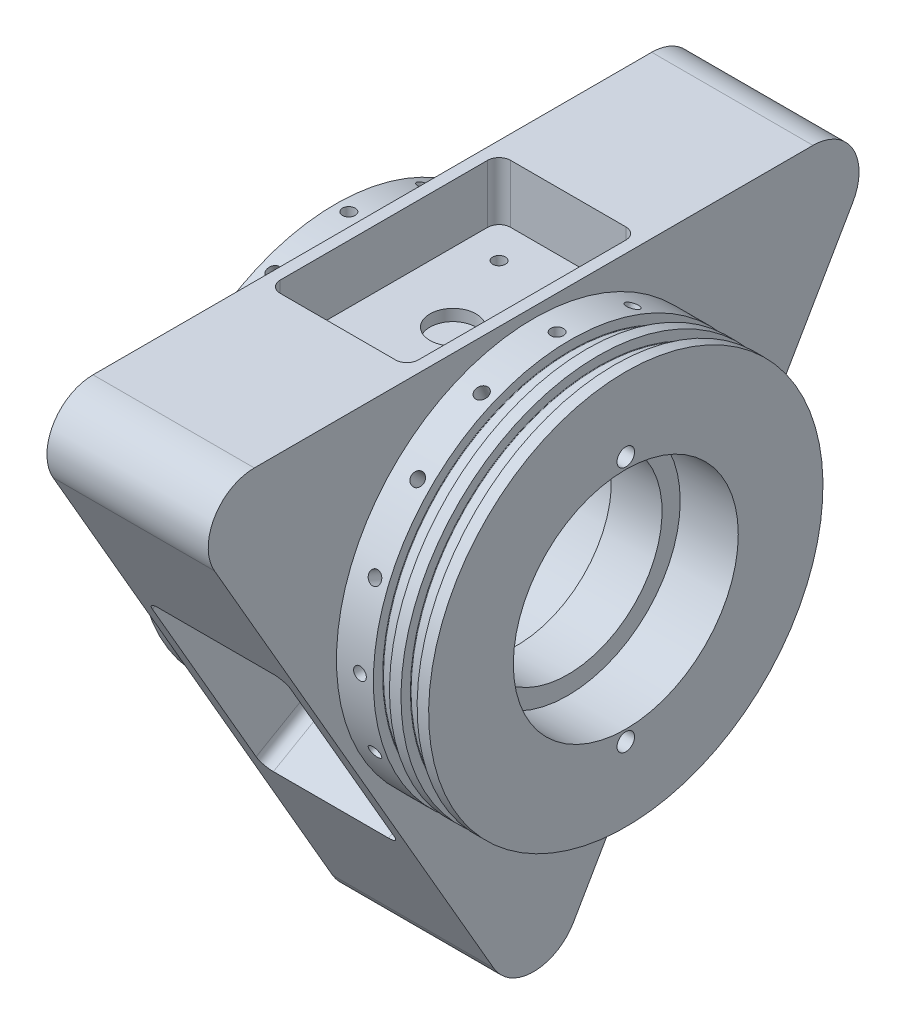
from build123d import *

# Parameters (mm, degrees)
BOSS_EXTRUDE1_DEPTH              = 22.225
CIRPATTERN1_COUNT                = 16
SKETCH11_R                       = 31
CUT_EXTRUDE2_DEPTH               = 16
SKETCH13_R                       = 36
CUT_EXTRUDE3_DEPTH               = 34.036
CUT_EXTRUDE4_START               = -16
SKETCH14_R                       = 31
CUT_EXTRUDE4_DEPTH               = 16
CUT_EXTRUDE5_REACH               = 161.269
SKETCH15_R                       = 26
F_10_24_TAPPED_HOLE1_D           = 3.7973
F_10_24_TAPPED_HOLE1_DEPTH       = 12.7
F_10_24_TAPPED_HOLE1_CBORE_D     = 4.826
F_10_24_TAPPED_HOLE1_CBORE_DEPTH = 9.652
F_10_24_TAPPED_HOLE1_TIP         = 1.140824014
SKETCH19_W                       = 38.1
SKETCH19_H                       = 63.5
CUT_EXTRUDE6_DEPTH               = 16.002
F_6_32_TAPPED_HOLE3_AT_2_COUNT   = 2
F_6_32_TAPPED_HOLE3_AT_2_PITCH   = 19.05
F_6_32_TAPPED_HOLE3_AT_3_COUNT   = 2
F_6_32_TAPPED_HOLE3_AT_3_PITCH   = 48.360159222
F_6_32_TAPPED_HOLE3_AT_4_COUNT   = 2
F_6_32_TAPPED_HOLE3_AT_4_PITCH   = 44.45
SKETCH24_R                       = 6.35
CUT_EXTRUDE7_DEPTH               = 3.175
CIRPATTERN2_COUNT                = 3
CHAMFER1_SIZE                    = 1.27
FILLET1_R                        = 0.127
FILLET2_R                        = 3.175
FILLET3_R                        = 12.7


with BuildPart() as part:
    # Sketch1 → Boss-Extrude1 (new, symmetric)
    with BuildSketch(Plane(origin=(0, 0, 0), x_dir=(0, 0, -1), z_dir=(1, 0, 0))):
        Polygon((-98.986703653, 57.15), (98.986703653, 57.15), (0, -114.3), align=None)
    extrude(amount=BOSS_EXTRUDE1_DEPTH, both=True)

    # Sketch3 → Revolve1 (revolve)
    with BuildSketch(Plane.XY):
        Polygon((32.385, 0), (0, 0), (0, 57.15), (22.225, 57.15), (22.225, 54.3433), (32.385, 54.3433), align=None)
    revolve1 = revolve(axis=Axis((32.385, 0, 0), (-1, 0, 0)))

    # Sketch9 → #6-32 Tapped Hole2 (revolve, cut)
    with BuildSketch(Plane(origin=(28.702, 0, 54.3433), x_dir=(0, -1, 0), z_dir=(1, 0, 0))):
        Polygon((0, 0), (0, 10.97269403), (1.35255, 10.16), (1.35255, 7.62), (1.7526, 7.62), (1.7526, 0), align=None)
    f_6_32_tapped_hole2 = revolve(axis=Axis((28.702, 0, 60.6933), (0, 0, -1)), mode=Mode.SUBTRACT)

    # CirPattern1: #6-32 Tapped Hole2 ×16 about axis
    cirpattern1_axis = Axis((32.385, 0, 0), (1, 0, 0))
    for i in range(1, CIRPATTERN1_COUNT):
        add(f_6_32_tapped_hole2.rotate(cirpattern1_axis, i * 360 / CIRPATTERN1_COUNT), mode=Mode.SUBTRACT)

    # Mirror3: Revolve1 across plane
    add(revolve1.mirror(Plane(origin=(0, 0, 0), x_dir=(0, 0, 1), z_dir=(1, 0, 0))))

    # Mirror3 copy 1 sketch → Mirror3 copy 1 (revolve, cut)
    with BuildSketch(Plane(origin=(-28.702, -20.79628057, 50.206662599), x_dir=(0, -0.9238795325112867, -0.3826834323650898), z_dir=(-1, 0, 0))):
        Polygon((0, 0), (0, -10.97269403), (1.35255, -10.16), (1.35255, -7.62), (1.7526, -7.62), (1.7526, 0), align=None)
    revolve(axis=Axis((-28.702, -23.226320366, 56.073297631), (0, -0.3826834323650898, 0.9238795325112867)), mode=Mode.SUBTRACT)

    # Mirror3 copy 2 sketch → Mirror3 copy 2 (revolve, cut)
    with BuildSketch(Plane(origin=(-28.702, -38.426515942, 38.426515942), x_dir=(0, -0.7071067811865476, -0.7071067811865475), z_dir=(-1, 0, 0))):
        Polygon((0, 0), (0, -10.97269403), (1.35255, -10.16), (1.35255, -7.62), (1.7526, -7.62), (1.7526, 0), align=None)
    revolve(axis=Axis((-28.702, -42.916644003, 42.916644003), (0, -0.7071067811865475, 0.7071067811865476)), mode=Mode.SUBTRACT)

    # Mirror3 copy 3 sketch → Mirror3 copy 3 (revolve, cut)
    with BuildSketch(Plane(origin=(-28.702, -50.206662599, 20.79628057), x_dir=(0, -0.38268343236508984, -0.9238795325112867), z_dir=(-1, 0, 0))):
        Polygon((0, 0), (0, -10.97269403), (1.35255, -10.16), (1.35255, -7.62), (1.7526, -7.62), (1.7526, 0), align=None)
    revolve(axis=Axis((-28.702, -56.073297631, 23.226320366), (0, -0.9238795325112867, 0.38268343236508984)), mode=Mode.SUBTRACT)

    # Mirror3 copy 4 sketch → Mirror3 copy 4 (revolve, cut)
    with BuildSketch(Plane(origin=(-28.702, -54.3433, 0), x_dir=(0, 0, -1), z_dir=(-1, 0, 0))):
        Polygon((0, 0), (0, -10.97269403), (1.35255, -10.16), (1.35255, -7.62), (1.7526, -7.62), (1.7526, 0), align=None)
    revolve(axis=Axis((-28.702, -60.6933, 0), (0, -1, 0)), mode=Mode.SUBTRACT)

    # Mirror3 copy 5 sketch → Mirror3 copy 5 (revolve, cut)
    with BuildSketch(Plane(origin=(-28.702, -50.206662599, -20.79628057), x_dir=(0, 0.3826834323650897, -0.9238795325112867), z_dir=(-1, 0, 0))):
        Polygon((0, 0), (0, -10.97269403), (1.35255, -10.16), (1.35255, -7.62), (1.7526, -7.62), (1.7526, 0), align=None)
    revolve(axis=Axis((-28.702, -56.073297631, -23.226320366), (0, -0.9238795325112867, -0.3826834323650897)), mode=Mode.SUBTRACT)

    # Mirror3 copy 6 sketch → Mirror3 copy 6 (revolve, cut)
    with BuildSketch(Plane(origin=(-28.702, -38.426515942, -38.426515942), x_dir=(0, 0.7071067811865475, -0.7071067811865476), z_dir=(-1, 0, 0))):
        Polygon((0, 0), (0, -10.97269403), (1.35255, -10.16), (1.35255, -7.62), (1.7526, -7.62), (1.7526, 0), align=None)
    revolve(axis=Axis((-28.702, -42.916644003, -42.916644003), (0, -0.7071067811865476, -0.7071067811865475)), mode=Mode.SUBTRACT)

    # Mirror3 copy 7 sketch → Mirror3 copy 7 (revolve, cut)
    with BuildSketch(Plane(origin=(-28.702, -20.79628057, -50.206662599), x_dir=(0, 0.9238795325112867, -0.3826834323650899), z_dir=(-1, 0, 0))):
        Polygon((0, 0), (0, -10.97269403), (1.35255, -10.16), (1.35255, -7.62), (1.7526, -7.62), (1.7526, 0), align=None)
    revolve(axis=Axis((-28.702, -23.226320366, -56.073297631), (0, -0.3826834323650899, -0.9238795325112867)), mode=Mode.SUBTRACT)

    # Mirror3 copy 8 sketch → Mirror3 copy 8 (revolve, cut)
    with BuildSketch(Plane(origin=(-28.702, 0, -54.3433), x_dir=(0, 1, 0), z_dir=(-1, 0, 0))):
        Polygon((0, 0), (0, -10.97269403), (1.35255, -10.16), (1.35255, -7.62), (1.7526, -7.62), (1.7526, 0), align=None)
    revolve(axis=Axis((-28.702, 0, -60.6933), (0, 0, -1)), mode=Mode.SUBTRACT)

    # Mirror3 copy 9 sketch → Mirror3 copy 9 (revolve, cut)
    with BuildSketch(Plane(origin=(-28.702, 20.79628057, -50.206662599), x_dir=(0, 0.9238795325112868, 0.38268343236508967), z_dir=(-1, 0, 0))):
        Polygon((0, 0), (0, -10.97269403), (1.35255, -10.16), (1.35255, -7.62), (1.7526, -7.62), (1.7526, 0), align=None)
    revolve(axis=Axis((-28.702, 23.226320366, -56.073297631), (0, 0.38268343236508967, -0.9238795325112868)), mode=Mode.SUBTRACT)

    # Mirror3 copy 10 sketch → Mirror3 copy 10 (revolve, cut)
    with BuildSketch(Plane(origin=(-28.702, 38.426515942, -38.426515942), x_dir=(0, 0.7071067811865477, 0.7071067811865475), z_dir=(-1, 0, 0))):
        Polygon((0, 0), (0, -10.97269403), (1.35255, -10.16), (1.35255, -7.62), (1.7526, -7.62), (1.7526, 0), align=None)
    revolve(axis=Axis((-28.702, 42.916644003, -42.916644003), (0, 0.7071067811865475, -0.7071067811865477)), mode=Mode.SUBTRACT)

    # Mirror3 copy 11 sketch → Mirror3 copy 11 (revolve, cut)
    with BuildSketch(Plane(origin=(-28.702, 50.206662599, -20.79628057), x_dir=(0, 0.3826834323650895, 0.9238795325112868), z_dir=(-1, 0, 0))):
        Polygon((0, 0), (0, -10.97269403), (1.35255, -10.16), (1.35255, -7.62), (1.7526, -7.62), (1.7526, 0), align=None)
    revolve(axis=Axis((-28.702, 56.073297631, -23.226320366), (0, 0.9238795325112868, -0.3826834323650895)), mode=Mode.SUBTRACT)

    # Mirror3 copy 12 sketch → Mirror3 copy 12 (revolve, cut)
    with BuildSketch(Plane(origin=(-28.702, 54.3433, 0), x_dir=(0, 0, 1), z_dir=(-1, 0, 0))):
        Polygon((0, 0), (0, -10.97269403), (1.35255, -10.16), (1.35255, -7.62), (1.7526, -7.62), (1.7526, 0), align=None)
    revolve(axis=Axis((-28.702, 60.6933, 0), (0, 1, 0)), mode=Mode.SUBTRACT)

    # Mirror3 copy 13 sketch → Mirror3 copy 13 (revolve, cut)
    with BuildSketch(Plane(origin=(-28.702, 50.206662599, 20.79628057), x_dir=(0, -0.38268343236509, 0.9238795325112866), z_dir=(-1, 0, 0))):
        Polygon((0, 0), (0, -10.97269403), (1.35255, -10.16), (1.35255, -7.62), (1.7526, -7.62), (1.7526, 0), align=None)
    revolve(axis=Axis((-28.702, 56.073297631, 23.226320366), (0, 0.9238795325112866, 0.38268343236509)), mode=Mode.SUBTRACT)

    # Mirror3 copy 14 sketch → Mirror3 copy 14 (revolve, cut)
    with BuildSketch(Plane(origin=(-28.702, 38.426515942, 38.426515942), x_dir=(0, -0.7071067811865474, 0.7071067811865477), z_dir=(-1, 0, 0))):
        Polygon((0, 0), (0, -10.97269403), (1.35255, -10.16), (1.35255, -7.62), (1.7526, -7.62), (1.7526, 0), align=None)
    revolve(axis=Axis((-28.702, 42.916644003, 42.916644003), (0, 0.7071067811865477, 0.7071067811865474)), mode=Mode.SUBTRACT)

    # Mirror3 copy 15 sketch → Mirror3 copy 15 (revolve, cut)
    with BuildSketch(Plane(origin=(-28.702, 20.79628057, 50.206662599), x_dir=(0, -0.9238795325112868, 0.38268343236508956), z_dir=(-1, 0, 0))):
        Polygon((0, 0), (0, -10.97269403), (1.35255, -10.16), (1.35255, -7.62), (1.7526, -7.62), (1.7526, 0), align=None)
    revolve(axis=Axis((-28.702, 23.226320366, 56.073297631), (0, 0.38268343236508956, 0.9238795325112868)), mode=Mode.SUBTRACT)

    # Mirror3 copy 16 sketch → Mirror3 copy 16 (revolve, cut)
    with BuildSketch(Plane(origin=(-28.702, 0, 54.3433), x_dir=(0, -1, 0), z_dir=(-1, 0, 0))):
        Polygon((0, 0), (0, -10.97269403), (1.35255, -10.16), (1.35255, -7.62), (1.7526, -7.62), (1.7526, 0), align=None)
    revolve(axis=Axis((-28.702, 0, 60.6933), (0, 0, 1)), mode=Mode.SUBTRACT)

    # Sketch10 → Revolve2 (revolve)
    with BuildSketch(Plane.XY):
        Polygon((32.385, 51.6636), (36.83, 51.6636), (36.83, 54.3433), (40.005, 54.3433), (40.005, 51.6636), (44.45, 51.6636), (44.45, 54.3433), (47.625, 54.3433), (47.625, 0), (32.385, 0), align=None)
    revolve(axis=Axis((47.625, 0, 0), (-1, 0, 0)))

    # Sketch11 → Cut-Extrude2 (cut)
    with BuildSketch(Plane(origin=(47.625, 0, 0), x_dir=(0, 0, -1), z_dir=(1, 0, 0))):
        Circle(SKETCH11_R)
    extrude(amount=-CUT_EXTRUDE2_DEPTH, mode=Mode.SUBTRACT)

    # Sketch13 → Cut-Extrude3 (cut)
    with BuildSketch(Plane.ZY.offset(32.385)):
        Circle(SKETCH13_R)
    extrude(amount=-CUT_EXTRUDE3_DEPTH, mode=Mode.SUBTRACT)

    # Sketch14 → Cut-Extrude4 (cut)
    with BuildSketch(Plane.ZY.offset(-1.651).offset(CUT_EXTRUDE4_START)):
        Circle(SKETCH14_R)
    extrude(amount=CUT_EXTRUDE4_DEPTH, mode=Mode.SUBTRACT)

    # Sketch15 → Cut-Extrude5 (cut, up to next)
    with BuildSketch(Plane.ZY.offset(-17.651), mode=Mode.PRIVATE) as cut_extrude5_sk1:
        Circle(SKETCH15_R)
    cut_extrude5_tool1 = extrude(cut_extrude5_sk1.sketch, amount=-CUT_EXTRUDE5_REACH, mode=Mode.PRIVATE) & part.part
    add(cut_extrude5_tool1.solids().sort_by_distance((17.651, 0, 0))[0], mode=Mode.SUBTRACT)

    # #10-24 Tapped Hole1
    with Locations(Plane(origin=(47.625, 34, 0), x_dir=(0, 1, 0), z_dir=(1, 0, 0))):
        with Locations((0, 0), (-68, 0)):
            CounterBoreHole(F_10_24_TAPPED_HOLE1_D / 2, F_10_24_TAPPED_HOLE1_CBORE_D / 2, F_10_24_TAPPED_HOLE1_CBORE_DEPTH, depth=F_10_24_TAPPED_HOLE1_DEPTH)
            with Locations((0, 0, -(F_10_24_TAPPED_HOLE1_DEPTH + F_10_24_TAPPED_HOLE1_TIP / 2))):  # 118° drill point
                Cone(0, F_10_24_TAPPED_HOLE1_D / 2, F_10_24_TAPPED_HOLE1_TIP, mode=Mode.SUBTRACT)

    # Sketch19 → Cut-Extrude6 (cut)
    with BuildSketch(Plane(origin=(0, 57.15, 0), x_dir=(1, 0, 0), z_dir=(0, 1, 0))):
        Rectangle(SKETCH19_W, SKETCH19_H)
    cut_extrude6 = extrude(amount=-CUT_EXTRUDE6_DEPTH, mode=Mode.SUBTRACT)

    # Sketch23 → #6-32 Tapped Hole3 (revolve, cut)
    with BuildSketch(Plane(origin=(-9.525, 41.148, -22.225), x_dir=(0, 0, 1), z_dir=(1, 0, 0))):
        Polygon((0, 0), (0, 10.46469403), (1.35255, 9.652), (1.35255, 5.588), (1.7526, 5.588), (1.7526, 0), align=None)
    f_6_32_tapped_hole3 = revolve(axis=Axis((-9.525, 47.498, -22.225), (0, -1, 0)), mode=Mode.SUBTRACT)

    # #6-32 Tapped Hole3 at 2: #6-32 Tapped Hole3 ×2
    with Locations(*[(i * F_6_32_TAPPED_HOLE3_AT_2_PITCH, 0, 0) for i in range(1, F_6_32_TAPPED_HOLE3_AT_2_COUNT)]):
        add(f_6_32_tapped_hole3, mode=Mode.SUBTRACT)

    # #6-32 Tapped Hole3 at 3: #6-32 Tapped Hole3 ×2
    with Locations(*[Vector(0.3939192985791679, 0, 0.9191450300180579) * (i * F_6_32_TAPPED_HOLE3_AT_3_PITCH) for i in range(1, F_6_32_TAPPED_HOLE3_AT_3_COUNT)]):
        add(f_6_32_tapped_hole3, mode=Mode.SUBTRACT)

    # #6-32 Tapped Hole3 at 4: #6-32 Tapped Hole3 ×2
    with Locations(*[(0, 0, i * F_6_32_TAPPED_HOLE3_AT_4_PITCH) for i in range(1, F_6_32_TAPPED_HOLE3_AT_4_COUNT)]):
        add(f_6_32_tapped_hole3, mode=Mode.SUBTRACT)

    # Sketch24 → Cut-Extrude7 (cut)
    with BuildSketch(Plane(origin=(0, 41.148, 0), x_dir=(1, 0, 0), z_dir=(0, 1, 0))):
        Circle(SKETCH24_R)
    cut_extrude7 = extrude(amount=-CUT_EXTRUDE7_DEPTH, mode=Mode.SUBTRACT)

    # CirPattern2: Cut-Extrude6, #6-32 Tapped Hole3, Cut-Extrude7 ×3 about axis
    cirpattern2_axis = Axis((47.625, 0, 0), (1, 0, 0))
    add([cut_extrude6.rotate(cirpattern2_axis, i * 360 / CIRPATTERN2_COUNT) for i in range(1, CIRPATTERN2_COUNT)], mode=Mode.SUBTRACT)
    add([f_6_32_tapped_hole3.rotate(cirpattern2_axis, i * 360 / CIRPATTERN2_COUNT) for i in range(1, CIRPATTERN2_COUNT)], mode=Mode.SUBTRACT)
    add([cut_extrude7.rotate(cirpattern2_axis, i * 360 / CIRPATTERN2_COUNT) for i in range(1, CIRPATTERN2_COUNT)], mode=Mode.SUBTRACT)

    # CirPattern2 copy 1 sketch → CirPattern2 copy 1 (revolve, cut)
    with BuildSketch(Plane(origin=(9.525, -1.326585401, 46.747713315), x_dir=(0, -0.8660254037844387, -0.4999999999999998), z_dir=(1, 0, 0))):
        Polygon((0, 0), (0, 10.46469403), (1.35255, 9.652), (1.35255, 5.588), (1.7526, 5.588), (1.7526, 0), align=None)
    revolve(axis=Axis((9.525, -4.501585401, 52.246974629), (0, 0.4999999999999998, -0.8660254037844387)), mode=Mode.SUBTRACT)

    # CirPattern2 copy 2 sketch → CirPattern2 copy 2 (revolve, cut)
    with BuildSketch(Plane(origin=(9.525, -39.821414599, -24.522713315), x_dir=(0, 0.8660254037844384, -0.5000000000000004), z_dir=(1, 0, 0))):
        Polygon((0, 0), (0, 10.46469403), (1.35255, 9.652), (1.35255, 5.588), (1.7526, 5.588), (1.7526, 0), align=None)
    revolve(axis=Axis((9.525, -42.996414599, -30.021974629), (0, 0.5000000000000004, 0.8660254037844384)), mode=Mode.SUBTRACT)

    # CirPattern2 copy 3 sketch → CirPattern2 copy 3 (revolve, cut)
    with BuildSketch(Plane(origin=(9.525, -39.821414599, 24.522713315), x_dir=(0, -0.8660254037844387, -0.4999999999999998), z_dir=(1, 0, 0))):
        Polygon((0, 0), (0, 10.46469403), (1.35255, 9.652), (1.35255, 5.588), (1.7526, 5.588), (1.7526, 0), align=None)
    revolve(axis=Axis((9.525, -42.996414599, 30.021974629), (0, 0.4999999999999998, -0.8660254037844387)), mode=Mode.SUBTRACT)

    # CirPattern2 copy 4 sketch → CirPattern2 copy 4 (revolve, cut)
    with BuildSketch(Plane(origin=(9.525, -1.326585401, -46.747713315), x_dir=(0, 0.8660254037844384, -0.5000000000000004), z_dir=(1, 0, 0))):
        Polygon((0, 0), (0, 10.46469403), (1.35255, 9.652), (1.35255, 5.588), (1.7526, 5.588), (1.7526, 0), align=None)
    revolve(axis=Axis((9.525, -4.501585401, -52.246974629), (0, 0.5000000000000004, 0.8660254037844384)), mode=Mode.SUBTRACT)

    # CirPattern2 copy 5 sketch → CirPattern2 copy 5 (revolve, cut)
    with BuildSketch(Plane(origin=(-9.525, -39.821414599, 24.522713315), x_dir=(0, -0.8660254037844387, -0.4999999999999998), z_dir=(1, 0, 0))):
        Polygon((0, 0), (0, 10.46469403), (1.35255, 9.652), (1.35255, 5.588), (1.7526, 5.588), (1.7526, 0), align=None)
    revolve(axis=Axis((-9.525, -42.996414599, 30.021974629), (0, 0.4999999999999998, -0.8660254037844387)), mode=Mode.SUBTRACT)

    # CirPattern2 copy 6 sketch → CirPattern2 copy 6 (revolve, cut)
    with BuildSketch(Plane(origin=(-9.525, -1.326585401, -46.747713315), x_dir=(0, 0.8660254037844384, -0.5000000000000004), z_dir=(1, 0, 0))):
        Polygon((0, 0), (0, 10.46469403), (1.35255, 9.652), (1.35255, 5.588), (1.7526, 5.588), (1.7526, 0), align=None)
    revolve(axis=Axis((-9.525, -4.501585401, -52.246974629), (0, 0.5000000000000004, 0.8660254037844384)), mode=Mode.SUBTRACT)

    # Chamfer1
    chamfer1_edges = [part.edges().sort_by_distance(p)[0] for p in [
        (-32.385, 0, -36),
    ]]
    chamfer(chamfer1_edges, length=CHAMFER1_SIZE)

    # Fillet1
    fillet1_edges = [part.edges().sort_by_distance(p)[0] for p in [
        (44.45, -51.6636, 0),
        (40.005, -51.6636, 0),
        (36.83, -51.6636, 0),
        (32.385, -51.6636, 0),
    ]]
    fillet(fillet1_edges, radius=FILLET1_R)

    # Fillet2
    fillet2_edges = [part.edges().sort_by_distance(p)[0] for p in [
        (-19.05, 2.92180657, -58.439282571),
        (19.05, 2.92180657, -58.439282571),
        (-19.05, -52.07080657, -26.689282571),
        (19.05, -52.07080657, -26.689282571),
        (19.05, -52.07080657, 26.689282571),
        (19.05, 2.92180657, 58.439282571),
        (-19.05, -52.07080657, 26.689282571),
        (-19.05, 2.92180657, 58.439282571),
        (19.05, 49.149, 31.75),
        (19.05, 49.149, -31.75),
        (-19.05, 49.149, 31.75),
        (-19.05, 49.149, -31.75),
    ]]
    fillet(fillet2_edges, radius=FILLET2_R)

    # Fillet3
    fillet3_edges = [part.edges().sort_by_distance(p)[0] for p in [
        (0, -114.3, 0),
        (0, 57.15, -98.986703653),
        (0, 57.15, 98.986703653),
    ]]
    fillet(fillet3_edges, radius=FILLET3_R)


solid = part.part
